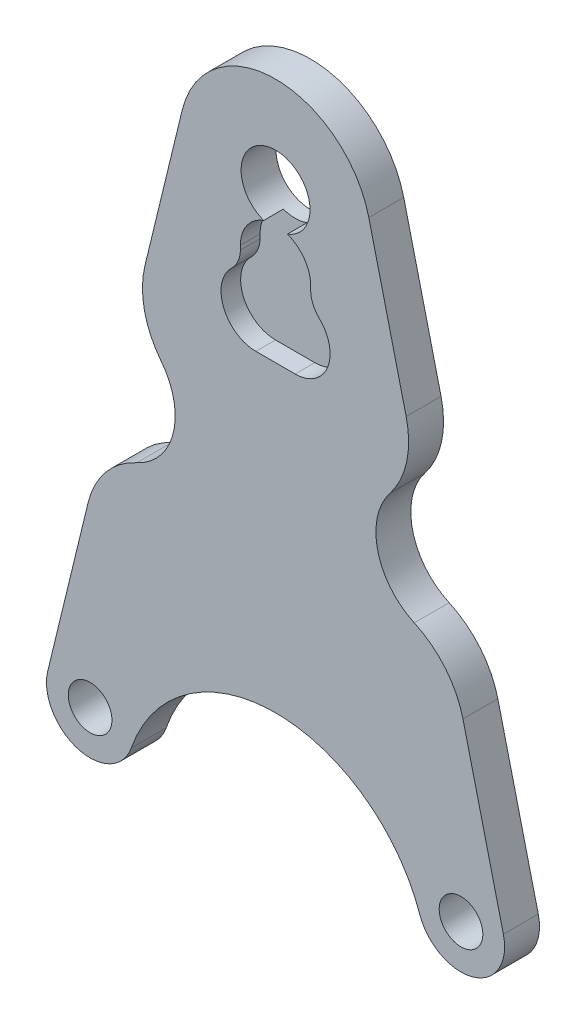
from build123d import *

# Parameters (mm, degrees)
SKETCH_1_R          = 7.9
SKETCH_1_R_2        = 5
EXTRUDE_1_DEPTH     = 8
CUT_EXTRUDE_1_DEPTH = 4.5
SKETCH_3_R          = 15
CUT_EXTRUDE_2_DEPTH = 145.139689191
FILLET_1_R          = 20


with BuildPart() as part:
    # Эскиз1 → Бобышка-Вытянуть1 (new body)
    with BuildSketch(Plane.XY):
        with BuildLine():
            Line((-21.377154159, 5.197814933), (-52.216888254, -121.637356848))
            ThreePointArc((-52.216888254, -121.637356848), (-45.327959859, -133.591800823), (-33.055555556, -127.286710991))
            ThreePointArc((-33.055555556, -127.286710991), (0, -103.790199458), (33.055555556, -127.286710991))
            ThreePointArc((33.055555556, -127.286710991), (45.327959859, -133.591800823), (52.216888254, -121.637356848))
            Line((52.216888254, -121.637356848), (21.377154159, 5.197814933))
            ThreePointArc((21.377154159, 5.197814933), (0, 22), (-21.377154159, 5.197814933))
        make_face()
        Circle(SKETCH_1_R, mode=Mode.SUBTRACT)
        with Locations((-42.5, -124)):
            Circle(SKETCH_1_R_2, mode=Mode.SUBTRACT)
        with Locations((42.5, -124)):
            Circle(SKETCH_1_R_2, mode=Mode.SUBTRACT)
    extrude(amount=EXTRUDE_1_DEPTH)

    # Эскиз2 → Вырез-Вытянуть1 (cut)
    with BuildSketch(Plane.XY.offset(8)):
        with BuildLine():
            Line((4.5, -34.3), (-4.5, -34.3))
            ThreePointArc((-4.5, -34.3), (-11.923093689, -29.282897935), (-10.035582708, -20.524420022))
            ThreePointArc((-10.035582708, -20.524420022), (-8.5923829, -18.459875841), (-8.05, -16))
            Line((-8.05, -16), (-8.05, -15))
            ThreePointArc((-8.05, -15), (0, -6.95), (8.05, -15))
            Line((8.05, -15), (8.05, -16))
            ThreePointArc((8.05, -16), (8.5923829, -18.459875841), (10.035582708, -20.524420022))
            ThreePointArc((10.035582708, -20.524420022), (11.923093689, -29.282897935), (4.5, -34.3))
        make_face()
    extrude(amount=-CUT_EXTRUDE_1_DEPTH, mode=Mode.SUBTRACT)

    # Эскиз3 → Вырез-Вытянуть2 (cut, through all)
    with BuildSketch(Plane.XY.offset(8)):
        with Locations((-38, -56.391488719)):
            Circle(SKETCH_3_R)
        with Locations((38, -56.391488719)):
            Circle(SKETCH_3_R)
    extrude(amount=-CUT_EXTRUDE_2_DEPTH, mode=Mode.SUBTRACT)

    # Скругление1
    fillet_1_edges = [part.edges().sort_by_distance(p)[0] for p in [
        (39.968167407, -71.261805362, 4),
        (32.920720313, -42.277633191, 4),
        (-39.968167407, -71.261805362, 4),
        (-32.920720313, -42.277633191, 4),
    ]]
    fillet(fillet_1_edges, radius=FILLET_1_R)


solid = part.part
